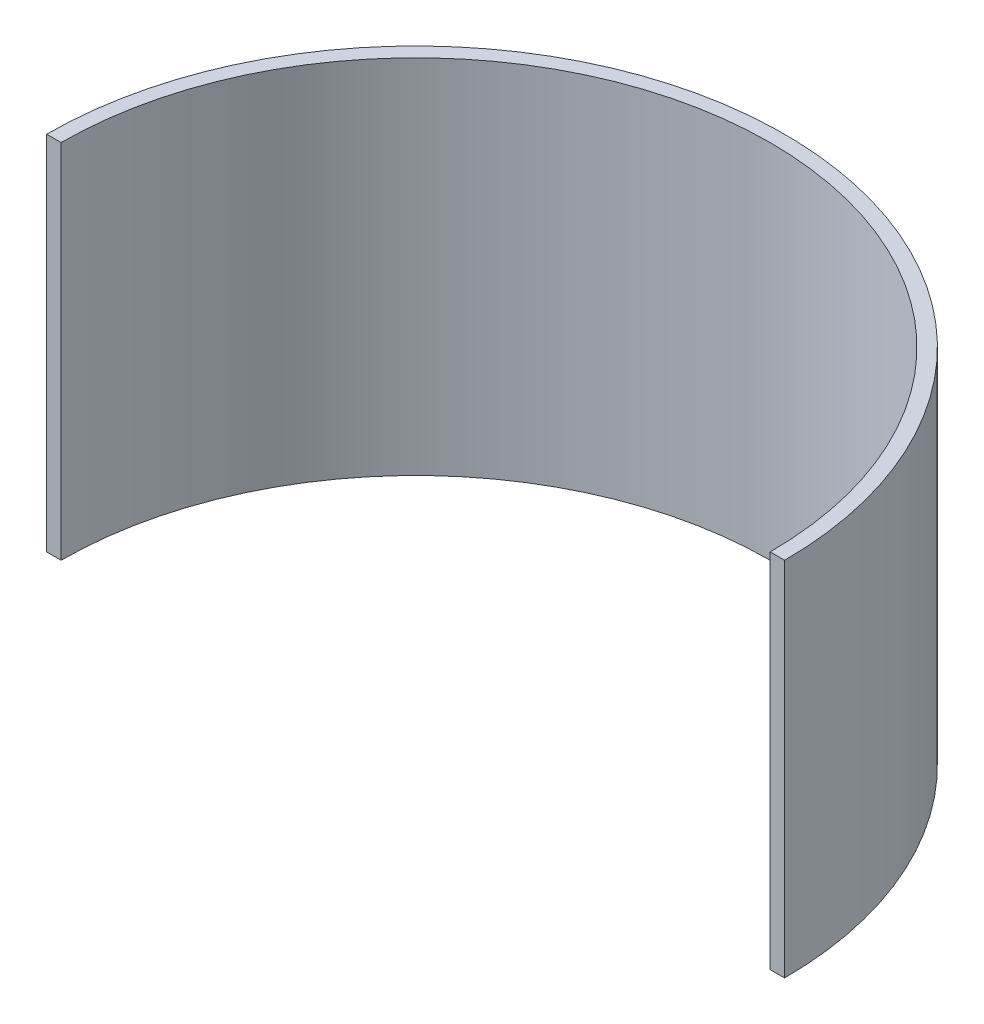
from build123d import *

# Parameters (mm, degrees)
BOSS_EXTRUDE1_DEPTH = 100


with BuildPart() as part:
    # Sketch1 → Boss-Extrude1 (new body)
    with BuildSketch(Plane(origin=(0, 0, 0), x_dir=(1, 0, 0), z_dir=(0, 1, 0))):
        with BuildLine():
            Line((-102, 0), (-98, 0))
            ThreePointArc((-98, 0), (0, 98), (98, 0))
            Line((98, 0), (102, 0))
            ThreePointArc((102, 0), (0, 102), (-102, 0))
        make_face()
    extrude(amount=BOSS_EXTRUDE1_DEPTH)


solid = part.part
